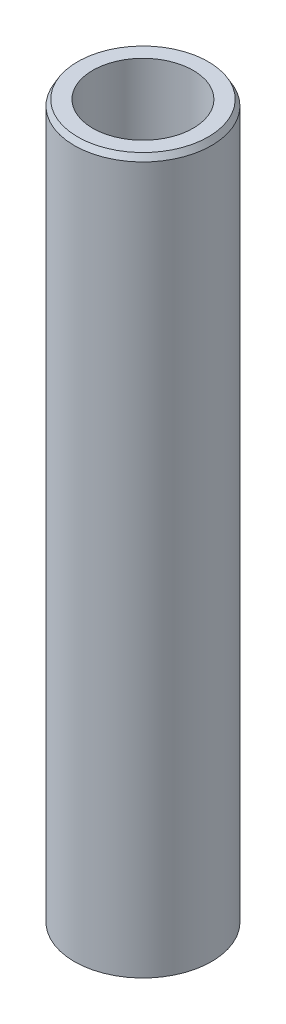
from build123d import *
from OCP.BRepFilletAPI import BRepFilletAPI_MakeChamfer

# Parameters (mm, degrees)
SKETCH1_R           = 57.5
BOSS_EXTRUDE1_DEPTH = 600
SKETCH2_R           = 42.086463616
CUT_EXTRUDE1_DEPTH  = 606.485342515
CHAMFER1_SIZE       = 4.858560382
CHAMFER1_SIZE2      = 2.805091144


with BuildPart() as part:
    # Sketch1 → Boss-Extrude1 (new body)
    with BuildSketch(Plane(origin=(0, 0, 0), x_dir=(1, 0, 0), z_dir=(0, 1, 0))):
        Circle(SKETCH1_R)
    extrude(amount=BOSS_EXTRUDE1_DEPTH)

    # Sketch2 → Cut-Extrude1 (cut, through all)
    with BuildSketch(Plane(origin=(0, 0, 0), x_dir=(1, 0, 0), z_dir=(0, 1, 0))):
        Circle(SKETCH2_R)
    extrude(amount=CUT_EXTRUDE1_DEPTH, mode=Mode.SUBTRACT)

    # Chamfer1: one chamfer whose edges measure the first distance from different faces: ONE call of the kernel's chamfer builder (chamfer() names one face for all edges)
    chamfer1_edges_1 = [part.edges().sort_by_distance(p)[0] for p in [
        (-57.5, 600, 0),
    ]]
    chamfer1_side_1 = [part.faces().sort_by_distance(p)[0] for p in [
        (-57.5, 300, 0),
    ]]
    chamfer1_edges_2 = [part.edges().sort_by_distance(p)[0] for p in [
        (-57.5, 0, 0),
    ]]
    chamfer1_side_2 = [part.faces().sort_by_distance(p)[0] for p in [
        (-55.873654403, 0, 0),
    ]]
    chamfer1 = BRepFilletAPI_MakeChamfer(part.part.solid().wrapped)
    for e in chamfer1_edges_1:
        chamfer1.Add(CHAMFER1_SIZE, CHAMFER1_SIZE2, e.wrapped, chamfer1_side_1[0].wrapped)  # the first distance lies on this face
    for e in chamfer1_edges_2:
        chamfer1.Add(CHAMFER1_SIZE, CHAMFER1_SIZE2, e.wrapped, chamfer1_side_2[0].wrapped)  # the first distance lies on this face
    add(Compound.cast(chamfer1.Shape()), mode=Mode.REPLACE)


solid = part.part
